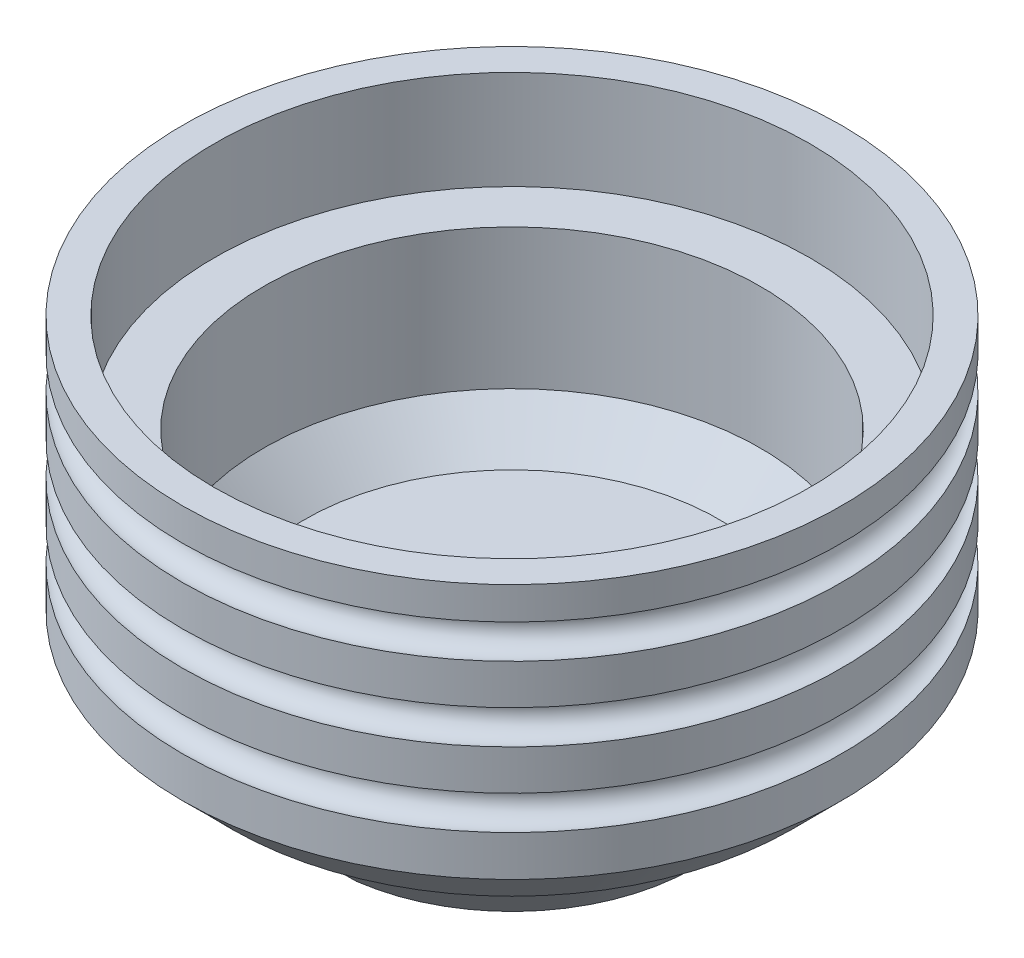
from build123d import *

# Parameters (mm, degrees)
CHAMFER_1_SIZE      = 5
EXTRUDE_START       = -11.5
EXTRUDE_1_DEPTH     = 11.5
CHAMFER_2_SIZE      = 12
CUT_EXTRUDE_START   = -16
SKETCH_4_W          = 6
SKETCH_4_H          = 6
CUT_EXTRUDE_1_DEPTH = 50.793692707
CUT_EXTRUDE_START_2 = 25
SKETCH_4_2_W        = 6
SKETCH_4_2_H        = 6
CUT_EXTRUDE_2_DEPTH = 41.793692707
SKETCH_5_R          = 1.65
CUT_EXTRUDE_3_DEPTH = 78.433907302
CHAMFER_3_SIZE      = 6


with BuildPart() as part:
    # ｽｹｯﾁ2 → 回転1 (revolve)
    with BuildSketch(Plane(origin=(0, 0, 0), x_dir=(0, 0, -1), z_dir=(1, 0, 0))):
        with BuildLine():
            Line((-16.125, -19), (-1.125, -19))
            Line((-1.125, -19), (-1.125, -6))
            Line((-1.125, -6), (-26.15, -6))
            Line((-26.15, -6), (-26.15, 16))
            Line((-26.15, 16), (-32.15, 16))
            Line((-32.15, 16), (-32.15, 28))
            Line((-32.15, 28), (-36, 28))
            Line((-36, 28), (-36, 24.065338955))
            ThreePointArc((-36, 24.065338955), (-34.186012747, 23.670048652), (-33.375, 22))
            ThreePointArc((-33.375, 22), (-34.186012747, 20.329951348), (-36, 19.934661045))
            Line((-36, 19.934661045), (-36, 15.065338955))
            ThreePointArc((-36, 15.065338955), (-34.186012747, 14.670048652), (-33.375, 13))
            ThreePointArc((-33.375, 13), (-34.186012747, 11.329951348), (-36, 10.934661045))
            Line((-36, 10.934661045), (-36, 6.065338955))
            ThreePointArc((-36, 6.065338955), (-34.186012747, 5.670048652), (-33.375, 4))
            ThreePointArc((-33.375, 4), (-34.186012747, 2.329951348), (-36, 1.934661045))
            Line((-36, 1.934661045), (-36, -9))
            Line((-36, -9), (-16.125, -9))
            Line((-16.125, -9), (-16.125, -19))
        make_face()
    revolve(axis=Axis((0, -2, -4), (0, -1, 0)))

    # 面取り1
    chamfer_1_edges = [part.edges().sort_by_distance(p)[0] for p in [
        (0, -6, -34.15),
    ]]
    chamfer(chamfer_1_edges, length=CHAMFER_1_SIZE)

    # ｽｹｯﾁ3 → ﾎﾞｽ - 押し出し1 (add)
    with BuildSketch(Plane.XZ.offset(19).offset(EXTRUDE_START)):
        with BuildLine():
            ThreePointArc((3.075, 0.1), (0, 1.125), (-3.075, 0.1))
            Line((-3.075, 0.1), (3.075, 0.1))
        make_face()
    extrude(amount=EXTRUDE_1_DEPTH)

    # 面取り2
    # the kernel refuses this chamfer: 12 mm, written as the material it adds along each edge
    with BuildSketch(Plane(origin=(0, -9, -4), x_dir=(0, 0, 1), z_dir=(1, 0, 0))) as chamfer_2_piece_1_section:
        Polygon((20.125, CHAMFER_2_SIZE), (20.125 + CHAMFER_2_SIZE, 0), (20.125, 0), align=None)
    chamfer_2_piece_1 = revolve(axis=Axis((0, -9, -4), (0, -1, 0)), mode=Mode.PRIVATE)
    chamfer_2_piece_1 = split(chamfer_2_piece_1, bisect_by=Plane(origin=(0, -19, -31.134676639), z_dir=(0, 1, 0)), keep=Keep.TOP, mode=Mode.PRIVATE)
    add(chamfer_2_piece_1)

    # ｽｹｯﾁ4 → ｶｯﾄ - 押し出し1 (cut, through all)
    with BuildSketch(Plane(origin=(0, 0, 0.1), x_dir=(-1, 0, 0), z_dir=(0, 0, -1)).offset(CUT_EXTRUDE_START)):
        with Locations((0, -17.000080491)):
            Rectangle(SKETCH_4_W, SKETCH_4_H)
    extrude(amount=-CUT_EXTRUDE_1_DEPTH, mode=Mode.SUBTRACT)

    # ｽｹｯﾁ4<2> → ｶｯﾄ - 押し出し2 (cut, through all)
    with BuildSketch(Plane(origin=(0, 0, 0.1), x_dir=(-1, 0, 0), z_dir=(0, 0, -1)).offset(CUT_EXTRUDE_START_2)):
        with Locations((0, -17.000080491)):
            Rectangle(SKETCH_4_2_W, SKETCH_4_2_H)
    extrude(amount=CUT_EXTRUDE_2_DEPTH, mode=Mode.SUBTRACT)

    # ｽｹｯﾁ5 → ｶｯﾄ - 押し出し3 (cut, through all)
    with BuildSketch(Plane.XY.offset(16.1)):
        with Locations((0, -17.000080491)):
            Circle(SKETCH_5_R)
    extrude(amount=-CUT_EXTRUDE_3_DEPTH, mode=Mode.SUBTRACT)

    # 面取り3
    chamfer_3_edges = [part.edges().sort_by_distance(p)[0] for p in [
        (0, -9, -44),
    ]]
    chamfer(chamfer_3_edges, length=CHAMFER_3_SIZE)


solid = part.part
